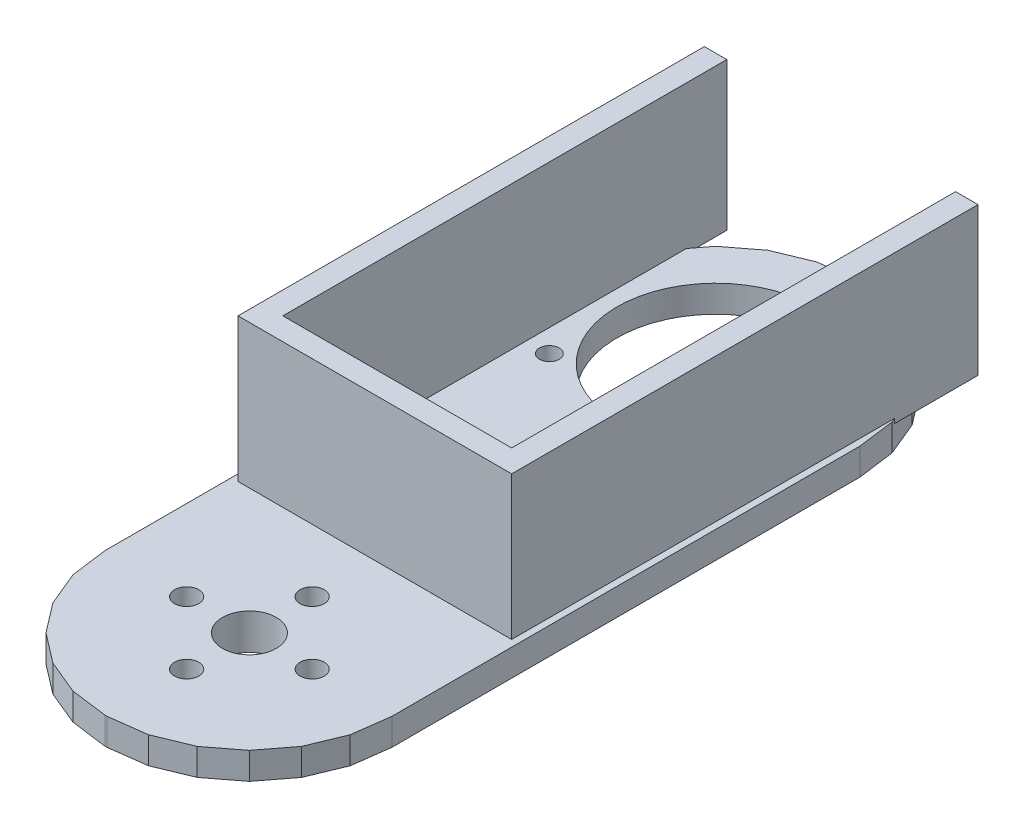
from build123d import *

# Parameters (mm, degrees)
S_CYL1_R      = 11
BOSS_1_DEPTH  = 1.1
BOSS_2_DEPTH  = 3
S_BOX3_W      = 2.5
S_BOX3_H      = 16.5
BOSS_3_DEPTH  = 52.01
S_BOX4_W      = 2.5
S_BOX4_H      = 16.5
BOSS_4_DEPTH  = 52.01
S_BOX5_W      = 30.52
S_BOX5_H      = 16.5
BOSS_5_DEPTH  = 2.5
S_HOLE6_R     = 3
HOLE_6_DEPTH  = 4.2
S_HOLE7_R     = 1.35
HOLE_7_DEPTH  = 4.2
S_HOLE8_R     = 1.35
HOLE_8_DEPTH  = 4.2
S_HOLE9_R     = 1.35
HOLE_9_DEPTH  = 4.2
S_HOLE10_R    = 1.35
HOLE_10_DEPTH = 4.2
S_HOLE11_R    = 11
HOLE_11_DEPTH = 3.2
S_HOLE12_R    = 1.1
HOLE_12_DEPTH = 3.2
S_HOLE13_R    = 1.1
HOLE_13_DEPTH = 3.2
S_HOLE14_R    = 1.1
HOLE_14_DEPTH = 3.2
S_HOLE15_R    = 1.1
HOLE_15_DEPTH = 3.2


with BuildPart() as part:
    # S_cyl1 → Boss_1 (new body)
    with BuildSketch(Plane(origin=(0, 0, 0), x_dir=(1, 0, 0), z_dir=(0, 1, 0))):
        Circle(S_CYL1_R)
    extrude(amount=BOSS_1_DEPTH)

    # S_prism2 → Boss_2 (add)
    with BuildSketch(Plane(origin=(0, 1, 0), x_dir=(1, 0, 0), z_dir=(0, 1, 0))):
        Polygon((-16, -0.1), (-15.458, -4.215), (-13.87, -8.05), (-11.343, -11.343), (-8.05, -13.87), (-4.215, -15.458), (-0.1, -16), (0.1, -16), (4.215, -15.458), (8.05, -13.87), (11.343, -11.343), (13.87, -8.05), (15.458, -4.215), (16, -0.1), (16, 52.1), (15.458, 56.215), (13.87, 60.05), (11.343, 63.343), (8.05, 65.87), (4.215, 67.458), (0.1, 68), (-0.1, 68), (-4.215, 67.458), (-8.05, 65.87), (-11.343, 63.343), (-13.87, 60.05), (-15.458, 56.215), (-16, 52.1), align=None)
    extrude(amount=BOSS_2_DEPTH)

    # S_box3 → Boss_3 (add)
    with BuildSketch(Plane.XY.offset(-66)):
        with Locations((14.01, 11.75)):
            Rectangle(S_BOX3_W, S_BOX3_H)
    extrude(amount=BOSS_3_DEPTH)

    # S_box4 → Boss_4 (add)
    with BuildSketch(Plane.XY.offset(-66)):
        with Locations((-14.01, 11.75)):
            Rectangle(S_BOX4_W, S_BOX4_H)
    extrude(amount=BOSS_4_DEPTH)

    # S_box5 → Boss_5 (add)
    with BuildSketch(Plane.XY.offset(-16.49)):
        with Locations((0, 11.75)):
            Rectangle(S_BOX5_W, S_BOX5_H)
    extrude(amount=BOSS_5_DEPTH)

    # S_hole6 → Hole_6 (cut)
    with BuildSketch(Plane(origin=(0, -0.1, 0), x_dir=(1, 0, 0), z_dir=(0, 1, 0))):
        Circle(S_HOLE6_R)
    extrude(amount=HOLE_6_DEPTH, mode=Mode.SUBTRACT)

    # S_hole7 → Hole_7 (cut)
    with BuildSketch(Plane(origin=(0, -0.1, 0), x_dir=(1, 0, 0), z_dir=(0, 1, 0))):
        with Locations((7, 0)):
            Circle(S_HOLE7_R)
    extrude(amount=HOLE_7_DEPTH, mode=Mode.SUBTRACT)

    # S_hole8 → Hole_8 (cut)
    with BuildSketch(Plane(origin=(0, -0.1, 0), x_dir=(1, 0, 0), z_dir=(0, 1, 0))):
        with Locations((0, -7)):
            Circle(S_HOLE8_R)
    extrude(amount=HOLE_8_DEPTH, mode=Mode.SUBTRACT)

    # S_hole9 → Hole_9 (cut)
    with BuildSketch(Plane(origin=(0, -0.1, 0), x_dir=(1, 0, 0), z_dir=(0, 1, 0))):
        with Locations((-7, 0)):
            Circle(S_HOLE9_R)
    extrude(amount=HOLE_9_DEPTH, mode=Mode.SUBTRACT)

    # S_hole10 → Hole_10 (cut)
    with BuildSketch(Plane(origin=(0, -0.1, 0), x_dir=(1, 0, 0), z_dir=(0, 1, 0))):
        with Locations((0, 7)):
            Circle(S_HOLE10_R)
    extrude(amount=HOLE_10_DEPTH, mode=Mode.SUBTRACT)

    # S_hole11 → Hole_11 (cut)
    with BuildSketch(Plane(origin=(0, 0.9, 0), x_dir=(1, 0, 0), z_dir=(0, 1, 0))):
        with Locations((0, 52)):
            Circle(S_HOLE11_R)
    extrude(amount=HOLE_11_DEPTH, mode=Mode.SUBTRACT)

    # S_hole12 → Hole_12 (cut)
    with BuildSketch(Plane(origin=(0, 0.9, 0), x_dir=(1, 0, 0), z_dir=(0, 1, 0))):
        with Locations((-10.25, 43.7)):
            Circle(S_HOLE12_R)
    extrude(amount=HOLE_12_DEPTH, mode=Mode.SUBTRACT)

    # S_hole13 → Hole_13 (cut)
    with BuildSketch(Plane(origin=(0, 0.9, 0), x_dir=(1, 0, 0), z_dir=(0, 1, 0))):
        with Locations((10.25, 43.7)):
            Circle(S_HOLE13_R)
    extrude(amount=HOLE_13_DEPTH, mode=Mode.SUBTRACT)

    # S_hole14 → Hole_14 (cut)
    with BuildSketch(Plane(origin=(0, 0.9, 0), x_dir=(1, 0, 0), z_dir=(0, 1, 0))):
        with Locations((-10.25, 19.25)):
            Circle(S_HOLE14_R)
    extrude(amount=HOLE_14_DEPTH, mode=Mode.SUBTRACT)

    # S_hole15 → Hole_15 (cut)
    with BuildSketch(Plane(origin=(0, 0.9, 0), x_dir=(1, 0, 0), z_dir=(0, 1, 0))):
        with Locations((10.25, 19.25)):
            Circle(S_HOLE15_R)
    extrude(amount=HOLE_15_DEPTH, mode=Mode.SUBTRACT)


solid = part.part
